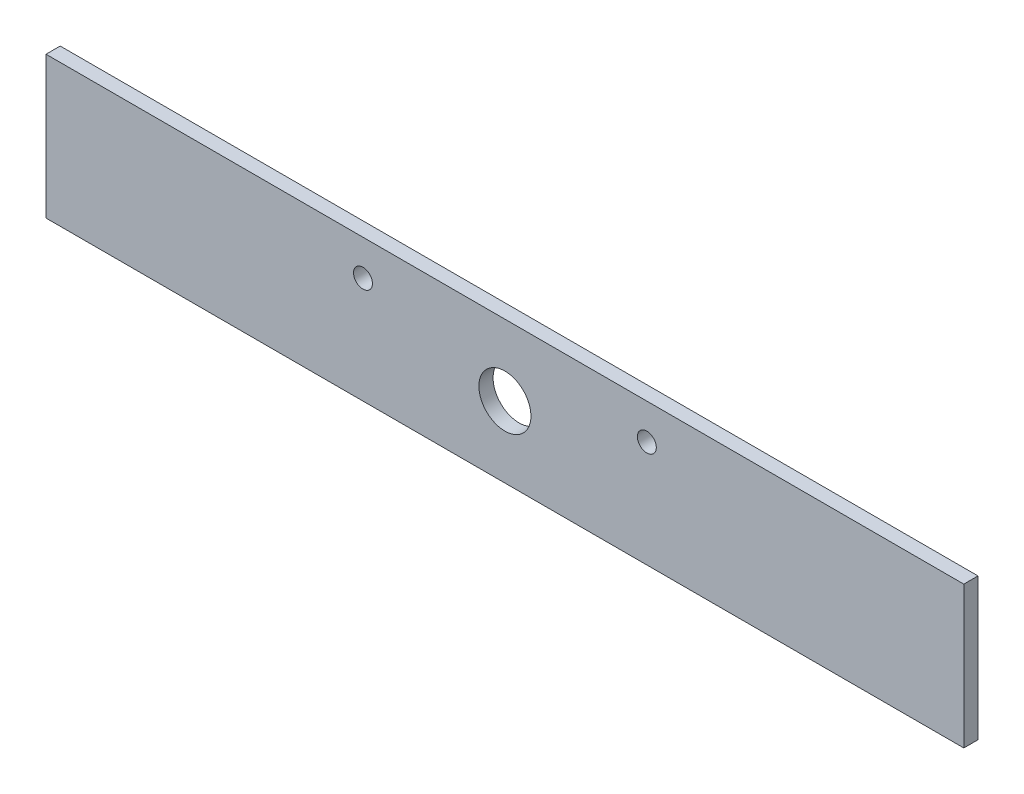
from build123d import *

# Parameters (mm, degrees)
SKETCH1_W           = 388
SKETCH1_H           = 60
SKETCH1_R           = 4
SKETCH1_R_2         = 11
BOSS_EXTRUDE1_DEPTH = 6


with BuildPart() as part:
    # Sketch1 → Boss-Extrude1 (new body)
    with BuildSketch(Plane.XY):
        Rectangle(SKETCH1_W, SKETCH1_H)
        with Locations((-60, 15)):
            Circle(SKETCH1_R, mode=Mode.SUBTRACT)
        Circle(SKETCH1_R_2, mode=Mode.SUBTRACT)
        with Locations((60, 15)):
            Circle(SKETCH1_R, mode=Mode.SUBTRACT)
    extrude(amount=BOSS_EXTRUDE1_DEPTH)


solid = part.part
